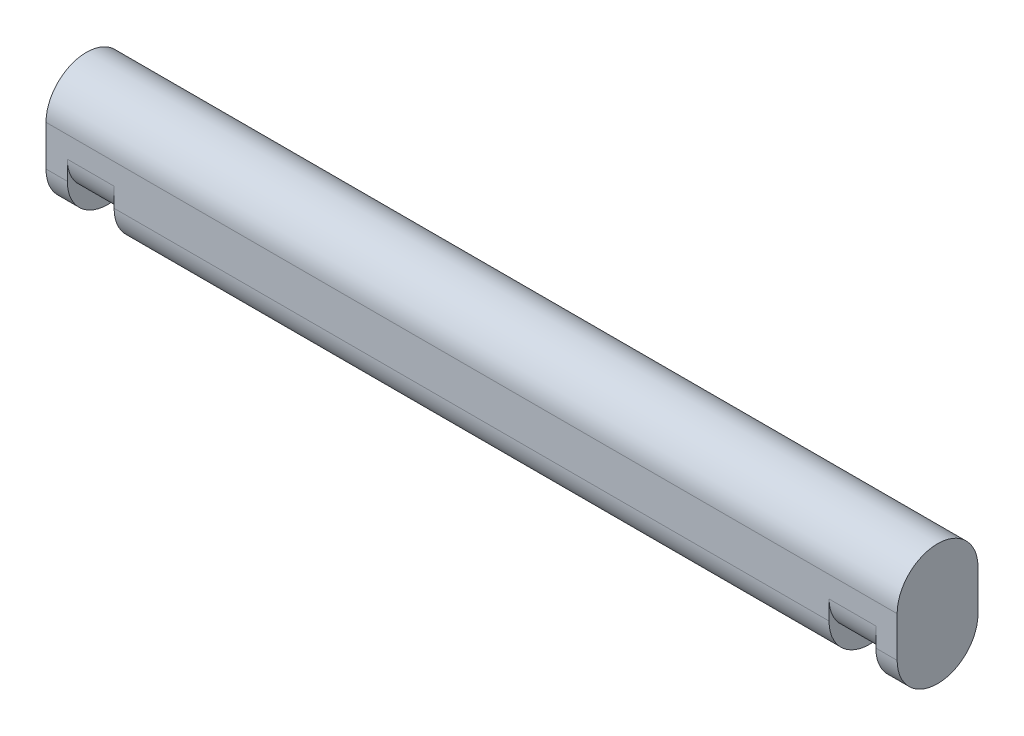
from build123d import *

# Parameters (mm, degrees)
BOSS_EXTRUDE1_DEPTH = 200
SKETCH2_W           = 11
SKETCH2_H           = 5
CUT_EXTRUDE1_DEPTH  = 10
FILLET1_R           = 9
MIRROR1_START       = 184
MIRROR1_DEPTH       = 11


with BuildPart() as part:
    # Sketch1 → Boss-Extrude1 (new body)
    with BuildSketch(Plane(origin=(0, 0, 0), x_dir=(0, 0, -1), z_dir=(1, 0, 0))):
        with BuildLine():
            Line((-9.5, 0), (-9.5, -9.5))
            ThreePointArc((-9.5, -9.5), (0, -19), (9.5, -9.5))
            Line((9.5, -9.5), (9.5, 0))
            ThreePointArc((9.5, 0), (0, 9.5), (-9.5, 0))
        make_face()
    extrude(amount=BOSS_EXTRUDE1_DEPTH)

    # Sketch2 → Cut-Extrude1 (cut, symmetric)
    with BuildSketch(Plane.XY):
        with Locations((10.5, -16.5)):
            Rectangle(SKETCH2_W, SKETCH2_H)
    extrude(amount=CUT_EXTRUDE1_DEPTH, both=True, mode=Mode.SUBTRACT)

    # Fillet1
    # the kernel refuses this fillet: 9 mm, written as the material it takes off along each edge
    with BuildSketch(Plane(origin=(16, -14, -8.366600265), x_dir=(0, 0.9921634898396948, -0.12494642623587741), z_dir=(-1, 0, 0))) as fillet1_piece_1:
        with BuildLine():
            CenterArc((7.946567819, -8.929471409), FILLET1_R, 82.822338024, 90)
            Line((-0.98290359, -7.804953572), (-1.875850731, -7.692501789))
            Line((-1.875850731, -7.692501789), (-0.892947141, 0.112451784))
            Line((-0.892947141, 0.112451784), (-0.323939264, 0.839680507))
            ThreePointArc((-0.323939264, 0.839680507), (4.718801734, 1.455206059), (9.183537439, 0.892947141))
            Line((9.183537439, 0.892947141), (9.071085655, 0))
        make_face()
    extrude(amount=11, mode=Mode.SUBTRACT)
    with BuildSketch(Plane(origin=(16, -14, 8.366600265), x_dir=(0, 0.9921634898396948, 0.1249464262358778), z_dir=(-1, 0, 0))) as fillet1_piece_2:
        with BuildLine():
            CenterArc((7.946567819, 8.929471409), FILLET1_R, 187.177661976, 90)
            Line((-0.98290359, 7.804953572), (-1.875850731, 7.692501789))
            Line((-1.875850731, 7.692501789), (-0.892947141, -0.112451784))
            Line((-0.892947141, -0.112451784), (-0.323939264, -0.839680507))
            ThreePointArc((-0.323939264, -0.839680507), (4.718801734, -1.455206059), (9.183537439, -0.892947141))
            Line((9.183537439, -0.892947141), (9.071085655, 0))
        make_face()
    extrude(amount=11, mode=Mode.SUBTRACT)

    # Mirror1: read off the stored shape, not the designer's step
    # Mirror1 outline → Mirror1 (cut)
    with BuildSketch(Plane.YZ.offset(MIRROR1_START)):
        with BuildLine():
            ThreePointArc((-5, -9.5), (-11.363961031, -6.863961031), (-14, -0.5))
            Line((-14, -0.5), (-14, 0.5))
            ThreePointArc((-14, 0.5), (-11.363961031, 6.863961031), (-5, 9.5))
            Line((-5, 9.5), (-9.5, 9.5))
            ThreePointArc((-9.5, 9.5), (-19, 0), (-9.5, -9.5))
            Line((-9.5, -9.5), (-5, -9.5))
        make_face()
    extrude(amount=MIRROR1_DEPTH, mode=Mode.SUBTRACT)


solid = part.part
